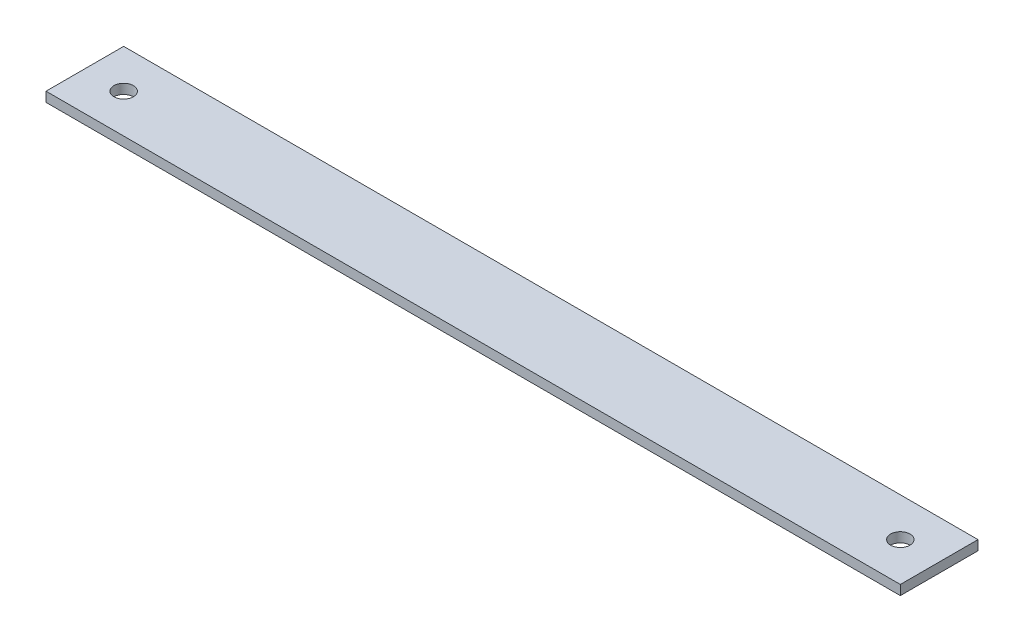
from build123d import *

# Parameters (mm, degrees)
SKETCH1_W           = 279.4
SKETCH1_H           = 25.4
BOSS_EXTRUDE1_DEPTH = 3.175
CUT_EXTRUDE1_REACH  = 142.312
SKETCH2_R           = 3.175


with BuildPart() as part:
    # Sketch1 → Boss-Extrude1 (new body)
    with BuildSketch(Plane(origin=(0, 0, 0), x_dir=(1, 0, 0), z_dir=(0, 1, 0))):
        Rectangle(SKETCH1_W, SKETCH1_H)
    extrude(amount=BOSS_EXTRUDE1_DEPTH)

    # Sketch2 → Cut-Extrude1 (cut, up to next)
    with BuildSketch(Plane(origin=(0, 3.175, 0), x_dir=(1, 0, 0), z_dir=(0, 1, 0)), mode=Mode.PRIVATE) as cut_extrude1_sk1:
        with Locations((-127, 0)):
            Circle(SKETCH2_R)
    cut_extrude1_tool1 = extrude(cut_extrude1_sk1.sketch, amount=-CUT_EXTRUDE1_REACH, mode=Mode.PRIVATE) & part.part
    # Sketch2 → Cut-Extrude1 (cut, up to next)
    with BuildSketch(Plane(origin=(0, 3.175, 0), x_dir=(1, 0, 0), z_dir=(0, 1, 0)), mode=Mode.PRIVATE) as cut_extrude1_sk2:
        with Locations((127, 0)):
            Circle(SKETCH2_R)
    cut_extrude1_tool2 = extrude(cut_extrude1_sk2.sketch, amount=-CUT_EXTRUDE1_REACH, mode=Mode.PRIVATE) & part.part
    add(cut_extrude1_tool1.solids().sort_by_distance((-127, 3.175, 0))[0], mode=Mode.SUBTRACT)
    add(cut_extrude1_tool2.solids().sort_by_distance((127, 3.175, 0))[0], mode=Mode.SUBTRACT)


solid = part.part
